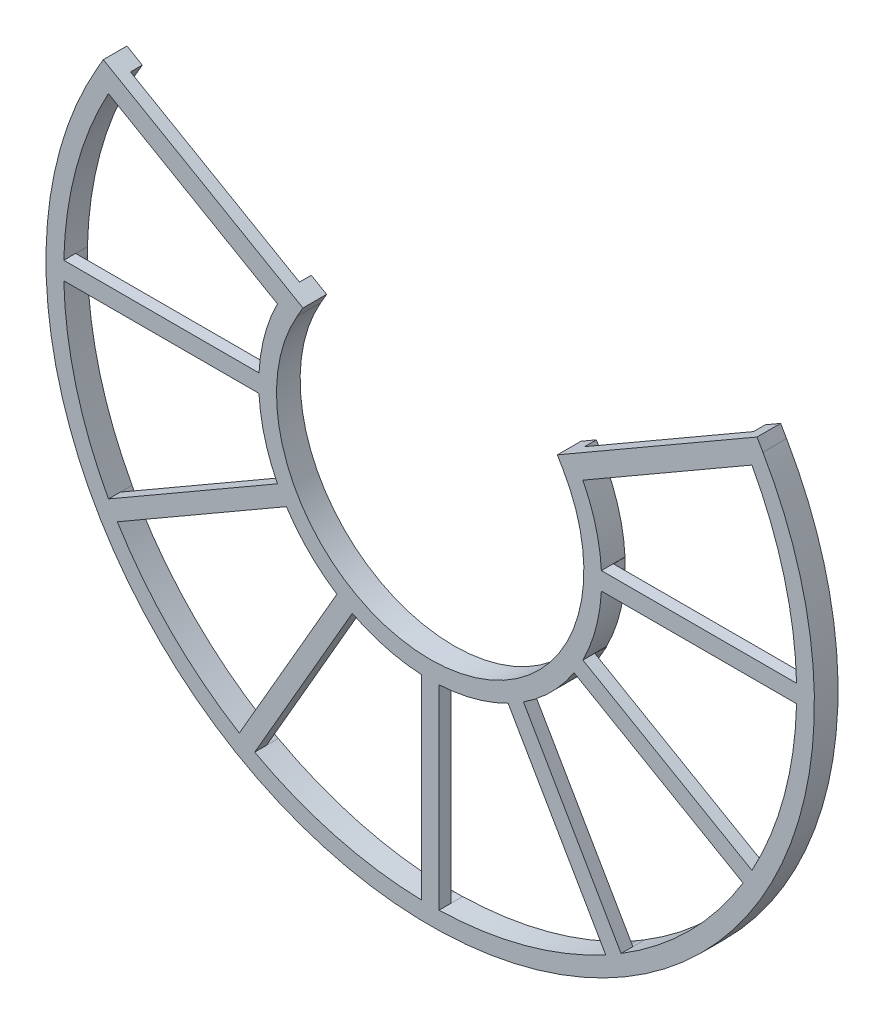
from build123d import *

# Parameters (mm, degrees)
BOSS_EXTRU_1_DEPTH             = 2
ESQUISSE2_W                    = 16.5
ESQUISSE2_H                    = 1
ENL_V_MAT_EXTRU_1_DEPTH        = 0.75
ESQUISSE3_W                    = 16.5
ESQUISSE3_H                    = 1
ENL_V_MAT_EXTRU_2_DEPTH        = 0.75
R_P_TITION_CIRCULAIRE1_DEPTH   = 2
R_P_TITION_START               = 1
R_P_TITION_CIRCULAIRE1_2_DEPTH = 1
BOSS_EXTRU_2_DEPTH             = 1
BOSS_EXTRU_3_DEPTH             = 1


# Read off the part's stored shape, not the designer's step: Répétition circulaire1
with BuildPart() as part:
    # Esquisse1 → Boss.-Extru.1 (new body)
    with BuildSketch(Plane.XY):
        with BuildLine():
            Line((11.258330249, 6.5), (28.145825623, 16.25))
            ThreePointArc((28.145825623, 16.25), (31.392589354, 8.411618966), (32.5, 0))
            Line((32.5, 0), (13, 0))
            ThreePointArc((13, 0), (12.557035742, 3.364647586), (11.258330249, 6.5))
        make_face()
        with BuildLine():
            Line((12.915559198, 6.590776176), (27.213929282, 14.845943993))
            ThreePointArc((27.213929282, 14.845943993), (29.943700615, 8.023390398), (30.990926091, 0.75))
            Line((30.990926091, 0.75), (14.480590458, 0.75))
            ThreePointArc((14.480590458, 0.75), (14.005924481, 3.752876154), (12.915559198, 6.590776176))
        make_face(mode=Mode.SUBTRACT)
    extrude(amount=BOSS_EXTRU_1_DEPTH)

    # Esquisse2 → Enlèv. mat.-Extru.1 (cut)
    with BuildSketch(Plane(origin=(0, 0, 0), x_dir=(0.866025403784438, 0.5000000000000011, 0), z_dir=(-0.5000000000000011, 0.8660254037844382, 0))):
        with Locations((22.75, -0.5)):
            Rectangle(ESQUISSE2_W, ESQUISSE2_H)
    extrude(amount=-ENL_V_MAT_EXTRU_1_DEPTH, mode=Mode.SUBTRACT)

    # Esquisse3 → Enlèv. mat.-Extru.2 (cut)
    with BuildSketch(Plane.XZ):
        with Locations((22.75, 0.5)):
            Rectangle(ESQUISSE3_W, ESQUISSE3_H)
    extrude(amount=-ENL_V_MAT_EXTRU_2_DEPTH, mode=Mode.SUBTRACT)

    # Répétition circulaire1 outline → Répétition circulaire1 (add)
    with BuildSketch(Plane.XY):
        with BuildLine():
            Line((14.500000002, 0), (13, 0))
            ThreePointArc((13, 0), (-3.363880515, -12.557241253), (-11.25912429, 6.498624487))
            Line((-11.25912429, 6.498624487), (-12.558254016, 7.248465774))
            Line((-12.558254016, 7.248465774), (-12.933174659, 6.598900911))
            Line((-12.933174659, 6.598900911), (-12.916364317, 6.589198194))
            ThreePointArc((-12.916364317, 6.589198194), (-14.006382877, 3.75116498), (-14.480681979, 0.748230857))
            Line((-14.480681979, 0.748230857), (-14.500091522, 0.748228486))
            Line((-14.500091522, 0.748228486), (-14.499999892, -0.001771509))
            Line((-14.499999892, -0.001771509), (-14.499921381, -0.751518432))
            Line((-14.499921381, -0.751518432), (-14.480511838, -0.7515164))
            ThreePointArc((-14.480511838, -0.7515164), (-14.005531404, -3.75434283), (-12.914868943, -6.592128654))
            Line((-12.914868943, -6.592128654), (-12.931677083, -6.601835185))
            Line((-12.931677083, -6.601835185), (-12.556609068, -7.251314965))
            Line((-12.556609068, -7.251314965), (-12.181678945, -7.900582135))
            Line((-12.181678945, -7.900582135), (-12.164870636, -7.890875897))
            ThreePointArc((-12.164870636, -7.890875897), (-10.252153541, -10.253943035), (-7.888752606, -12.166247668))
            Line((-7.888752606, -12.166247668), (-7.898455911, -12.183057672))
            Line((-7.898455911, -12.183057672), (-7.248904135, -12.558000989))
            Line((-7.248904135, -12.558000989), (-6.599578081, -12.932829124))
            Line((-6.599578081, -12.932829124), (-6.589874484, -12.91601929))
            ThreePointArc((-6.589874484, -12.91601929), (-3.751898347, -14.006186447), (-0.748989062, -14.480642782))
            Line((-0.748989062, -14.480642782), (-0.748987707, -14.500052325))
            Line((-0.748987707, -14.500052325), (0.001012291, -14.499999965))
            Line((0.001012291, -14.499999965), (0.750759217, -14.49996071))
            Line((0.750759217, -14.49996071), (0.750758201, -14.480551168))
            ThreePointArc((0.750758201, -14.480551168), (3.753609497, -14.005727962), (6.591452424, -12.915214088))
            Line((6.591452424, -12.915214088), (6.601158075, -12.932022737))
            Line((6.601158075, -12.932022737), (7.250657492, -12.556988728))
            Line((7.250657492, -12.556988728), (7.899944293, -12.182092602))
            Line((7.899944293, -12.182092602), (7.890238935, -12.165283784))
            ThreePointArc((7.890238935, -12.165283784), (10.25340622, -10.252690422), (12.165834597, -7.889389619))
            Line((12.165834597, -7.889389619), (12.182644093, -7.899093804))
            Line((12.182644093, -7.899093804), (12.55762142, -7.249561661))
            Line((12.55762142, -7.249561661), (12.932483553, -6.600255234))
            Line((12.932483553, -6.600255234), (12.915674227, -6.590550756))
            ThreePointArc((12.915674227, -6.590550756), (14.005989979, -3.752631704), (14.480603545, -0.749747266))
            Line((14.480603545, -0.749747266), (14.500013088, -0.749746927))
            Line((14.500013088, -0.749746927), (14.500000002, 0))
        make_face()
        with BuildLine():
            Line((32.5, 0), (31.000000004, 0))
            Line((31.000000004, 0), (31.000013085, -0.749458948))
            Line((31.000013085, -0.749458948), (30.990939177, -0.749459106))
            ThreePointArc((30.990939177, -0.749459106), (29.943840645, -8.022867781), (27.214188388, -14.845469018))
            Line((27.214188388, -14.845469018), (27.222046703, -14.850005835))
            Line((27.222046703, -14.850005835), (26.847328557, -15.499062863))
            Line((26.847328557, -15.499062863), (26.472351226, -16.148595003))
            Line((26.472351226, -16.148595003), (26.464492832, -16.144058323))
            ThreePointArc((26.464492832, -16.144058323), (21.921075367, -21.91954504), (16.145905854, -26.4633657))
            Line((16.145905854, -26.4633657), (16.150443083, -26.471223777))
            Line((16.150443083, -26.471223777), (15.501405676, -26.845975906))
            Line((15.501405676, -26.845975906), (14.851906256, -27.221009911))
            Line((14.851906256, -27.221009911), (14.847368891, -27.213151913))
            ThreePointArc((14.847368891, -27.213151913), (8.024958236, -29.94328047), (0.75162268, -30.990886779))
            Line((0.75162268, -30.990886779), (0.751623155, -30.999960688))
            Line((0.751623155, -30.999960688), (0.002164208, -30.999999929))
            Line((0.002164208, -30.999999929), (-0.74783579, -31.000052284))
            Line((-0.74783579, -31.000052284), (-0.747836423, -30.990978376))
            ThreePointArc((-0.747836423, -30.990978376), (-8.021299914, -29.94426068), (-14.844044066, -27.214965658))
            Line((-14.844044066, -27.214965658), (-14.848580472, -27.22282421))
            Line((-14.848580472, -27.22282421), (-15.497657119, -26.848140049))
            Line((-15.497657119, -26.848140049), (-16.147208892, -26.473196728))
            Line((-16.147208892, -26.473196728), (-16.142672624, -26.465338097))
            ThreePointArc((-16.142672624, -26.465338097), (-21.918397225, -21.922223041), (-26.462520266, -16.147291451))
            Line((-26.462520266, -16.147291451), (-26.470378105, -16.151829091))
            Line((-26.470378105, -16.151829091), (-26.845164218, -15.502811306))
            Line((-26.845164218, -15.502811306), (-27.220232229, -14.853331525))
            Line((-27.220232229, -14.853331525), (-27.212374469, -14.848793747))
            ThreePointArc((-27.212374469, -14.848793747), (-29.942860243, -8.026526051), (-30.990847382, -0.753245358))
            Line((-30.990847382, -0.753245358), (-30.99992129, -0.753246308))
            Line((-30.99992129, -0.753246308), (-30.999999773, -0.003787364))
            Line((-30.999999773, -0.003787364), (-31.000091398, 0.74621263))
            Line((-31.000091398, 0.74621263), (-30.99101749, 0.746213739))
            ThreePointArc((-30.99101749, 0.746213739), (-29.944680634, 8.019732025), (-27.215742853, 14.842619073))
            Line((-27.215742853, 14.842619073), (-27.223601643, 14.847155068))
            Line((-27.223601643, 14.847155068), (-26.848680999, 15.49671993))
            Line((-26.848680999, 15.49671993), (-28.147810725, 16.246561217))
            ThreePointArc((-28.147810725, 16.246561217), (-8.409701286, -31.393103132), (32.5, 0))
        make_face()
    extrude(amount=R_P_TITION_CIRCULAIRE1_DEPTH)

    # R_p_tition circulaire1 2 outline → R_p_tition circulaire1 2 (add)
    with BuildSketch(Plane.XY.offset(R_P_TITION_START)):
        Polygon((31.000000004, 0), (14.500000002, 0), (14.500013088, -0.749746927), (30.990939177, -0.749459106), (31.000013085, -0.749458948), align=None)
        Polygon((-12.933174659, 6.598900911), (-12.558254016, 7.248465774), (-26.848680999, 15.49671993), (-27.223601643, 14.847155068), (-27.215742853, 14.842619073), align=None)
        Polygon((27.222046703, -14.850005835), (27.214188388, -14.845469018), (12.932483553, -6.600255234), (12.557621422, -7.249561662), (12.182644093, -7.899093803), (26.464492832, -16.144058323), (26.472351226, -16.148595003), (26.847328553, -15.499062861), align=None)
        Polygon((-14.500091522, 0.748228486), (-30.99101749, 0.746213739), (-31.000091398, 0.74621263), (-30.999999769, -0.003787364), (-30.99992129, -0.753246308), (-30.990847382, -0.753245358), (-14.499921381, -0.751518433), (-14.499999894, -0.001771509), align=None)
        Polygon((16.150443083, -26.471223777), (16.145905854, -26.4633657), (7.899944293, -12.182092602), (7.250657493, -12.55698873), (6.601158075, -12.932022737), (14.84736889, -27.213151913), (14.851906256, -27.221009911), (15.501405673, -26.845975902), align=None)
        Polygon((-12.931677083, -6.601835185), (-27.212374469, -14.848793747), (-27.220232229, -14.853331525), (-26.845164214, -15.502811304), (-26.470378105, -16.151829091), (-26.462520266, -16.147291451), (-12.181678945, -7.900582135), (-12.55660907, -7.251314966), align=None)
        Polygon((0.751623155, -30.999960688), (0.75162268, -30.990886779), (0.750759217, -14.49996071), (0.001012291, -14.499999967), (-0.748987707, -14.500052325), (-0.747836423, -30.990978376), (-0.74783579, -31.000052284), (0.002164208, -30.999999924), align=None)
        Polygon((-7.898455911, -12.183057672), (-16.142672624, -26.465338097), (-16.147208892, -26.473196728), (-15.497657117, -26.848140045), (-14.848580472, -27.22282421), (-14.844044066, -27.214965658), (-6.599578081, -12.932829124), (-7.248904136, -12.558000991), align=None)
    extrude(amount=R_P_TITION_CIRCULAIRE1_2_DEPTH)

    # Esquisse5 → Boss.-Extru.2 (add)
    with BuildSketch(Plane(origin=(0, 0, 0), x_dir=(0.866025403784438, 0.5000000000000011, 0), z_dir=(-0.5000000000000011, 0.8660254037844382, 0))):
        Polygon((32.5, 0), (31, 0), (31, -1), (14.5, -1), (14.5, 0), (13, 0), (13, -2), (32.5, -2), align=None)
    extrude(amount=BOSS_EXTRU_2_DEPTH)

    # Esquisse6 → Boss.-Extru.3 (add)
    with BuildSketch(Plane(origin=(0, 0, 0), x_dir=(0.8660864838448452, -0.4998941913057929, 0), z_dir=(0.49989419130579293, 0.8660864838448453, 0))):
        Polygon((-14.5, -1), (-31, -1), (-31, 0), (-32.5, 0), (-32.5, -2), (-13, -2), (-13, 0), (-14.5, 0), align=None)
    extrude(amount=BOSS_EXTRU_3_DEPTH)


solid = part.part
